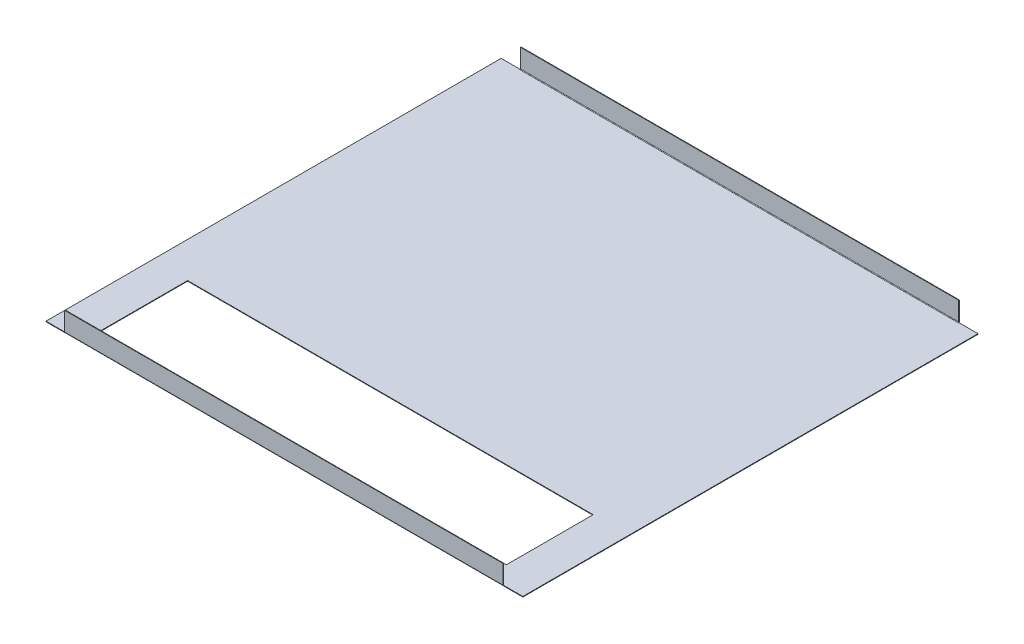
from build123d import *

# Parameters (mm, degrees)
SKETCH1_W                    = 990
SKETCH1_H                    = 945
SKETCH1_W_2                  = 842
SKETCH1_H_2                  = 180
BASE_FLANGE1_DEPTH           = 1.2
EDGE_FLANGE1_STRIP_W         = 7.2
EDGE_FLANGE1_STRIP_H         = 1.2
EDGE_FLANGE1_STRIP_CUT_DEPTH = 910
EDGE_FLANGE1_DEPTH           = 910
EDGE_FLANGE2_STRIP_W         = 7.2
EDGE_FLANGE2_STRIP_H         = 1.2
EDGE_FLANGE2_STRIP_CUT_DEPTH = 910
EDGE_FLANGE2_DEPTH           = 910


# Sheet-metal steps are written as plain solids
with BuildPart() as part:
    # Sketch1 → Base-Flange1 (new body)
    with BuildSketch(Plane(origin=(0, 0, 0), x_dir=(1, 0, 0), z_dir=(0, 1, 0))):
        Rectangle(SKETCH1_W, SKETCH1_H)
        with Locations((0, -342.5)):
            Rectangle(SKETCH1_W_2, SKETCH1_H_2, mode=Mode.SUBTRACT)
    extrude(amount=-BASE_FLANGE1_DEPTH)

    # Edge-Flange1 strip (across the edge) → Edge-Flange1 strip cut (cut)
    with BuildSketch(Plane(origin=(455, 0, -472.5), x_dir=(0, 0, 1), z_dir=(-1, 0, 0))):
        with Locations((-2.4, -0.6)):
            Rectangle(EDGE_FLANGE1_STRIP_W, EDGE_FLANGE1_STRIP_H)
    extrude(amount=EDGE_FLANGE1_STRIP_CUT_DEPTH, mode=Mode.SUBTRACT)

    # Edge-Flange1 section (across the edge) → Edge-Flange1 (add)
    with BuildSketch(Plane(origin=(455, 0, -472.5), x_dir=(0, 0, 1), z_dir=(-1, 0, 0))):
        with BuildLine():
            Line((-1.2, 1.2), (-1.2, 40))
            Line((-1.2, 40), (0, 40))
            Line((0, 40), (0, 1.2))
            ThreePointArc((0, 1.2), (0.351471863, 0.351471863), (1.2, 0))
            Line((1.2, 0), (1.2, -1.2))
            ThreePointArc((1.2, -1.2), (-0.497056275, -0.497056275), (-1.2, 1.2))
        make_face()
    extrude(amount=EDGE_FLANGE1_DEPTH)

    # Edge-Flange2 strip (across the edge) → Edge-Flange2 strip cut (cut)
    with BuildSketch(Plane(origin=(-455, 0, 472.5), x_dir=(0, 0, -1), z_dir=(1, 0, 0))):
        with Locations((-2.4, -0.6)):
            Rectangle(EDGE_FLANGE2_STRIP_W, EDGE_FLANGE2_STRIP_H)
    extrude(amount=EDGE_FLANGE2_STRIP_CUT_DEPTH, mode=Mode.SUBTRACT)

    # Edge-Flange2 section (across the edge) → Edge-Flange2 (add)
    with BuildSketch(Plane(origin=(-455, 0, 472.5), x_dir=(0, 0, -1), z_dir=(1, 0, 0))):
        with BuildLine():
            Line((-1.2, 1.2), (-1.2, 40))
            Line((-1.2, 40), (0, 40))
            Line((0, 40), (0, 1.2))
            ThreePointArc((0, 1.2), (0.351471863, 0.351471863), (1.2, 0))
            Line((1.2, 0), (1.2, -1.2))
            ThreePointArc((1.2, -1.2), (-0.497056275, -0.497056275), (-1.2, 1.2))
        make_face()
    extrude(amount=EDGE_FLANGE2_DEPTH)


solid = part.part
